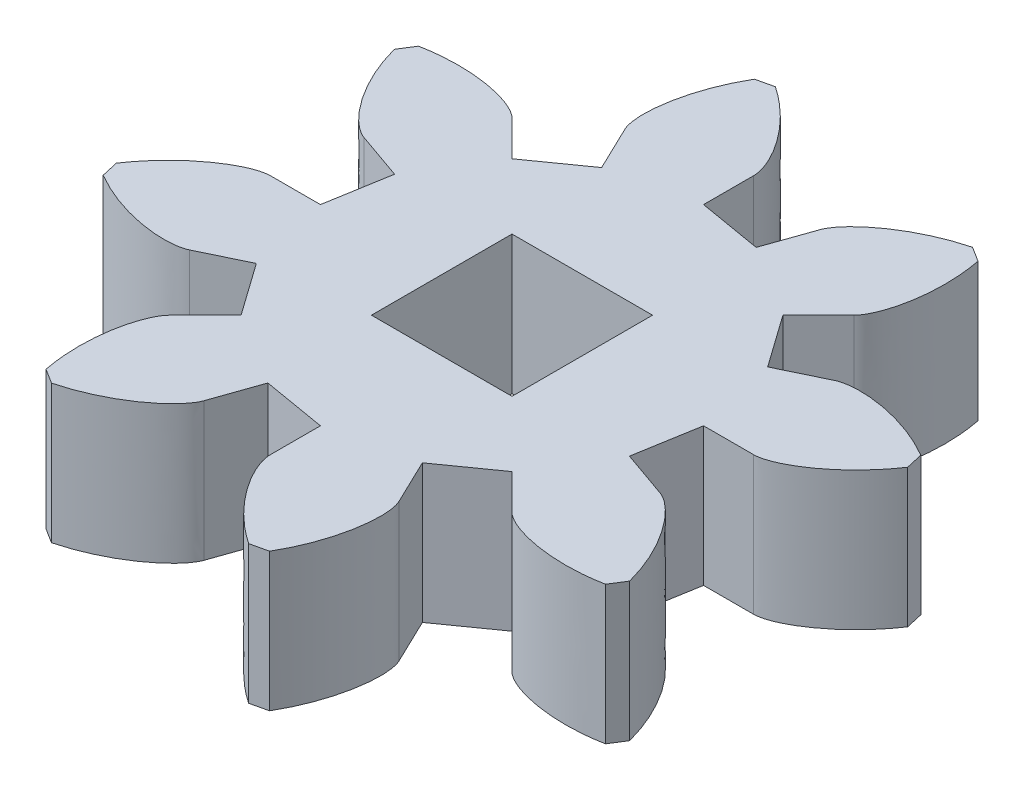
from build123d import *

# Parameters (mm, degrees)
BOSS_EXTRUDE1_DEPTH = 1.5
CIRPATTERN1_COUNT   = 8
SKETCH4_W           = 3.05
SKETCH4_H           = 3.05
CUT_EXTRUDE1_DEPTH  = 11.547606867


with BuildPart() as part:
    # Sketch5 → Boss-Extrude1 (new, symmetric)
    with BuildSketch(Plane(origin=(0, 0, 0), x_dir=(1, 0, 0), z_dir=(0, 1, 0))):
        with BuildLine():
            Line((0, 0), (3.342855658, 2.370565581))
            Line((3.342855658, 2.370565581), (3.746267067, 1.80169155))
            Line((3.746267067, 1.80169155), (4.726512919, 2.273109454))
            add(Edge.make_bspline(
                [(4.726512919, 2.273109454), (5.083840243, 2.444954607), (6.11501814, 2.361263688), (7.066052624, 1.805087159)],
                knots=[0, 0, 0, 0, 1, 1, 1, 1], degree=3))
            Line((7.066052624, 1.805087159), (7.108150593, 1.620429032))
            Line((7.108150593, 1.620429032), (7.150245001, 1.435770094))
            add(Edge.make_bspline(
                [(5.244706948, 7.012e-06), (5.641208616, 1.0552e-05), (6.534229602, 0.522356744), (7.150245001, 1.435770094)],
                knots=[0, 0, 0, 0, 1, 1, 1, 1], degree=3))
            Line((5.244706948, 7.012e-06), (4.156995234, -2.698e-06))
            Line((4.156995234, -2.698e-06), (4.039998902, -0.687512906))
            Line((4.039998902, -0.687512906), (0, 0))
        make_face()
    boss_extrude1 = extrude(amount=BOSS_EXTRUDE1_DEPTH, both=True)

    # CirPattern1: Boss-Extrude1 ×8 about axis
    cirpattern1_axis = Axis((0, -1.5, 0), (0, 1, 0))
    for i in range(1, CIRPATTERN1_COUNT):
        add(boss_extrude1.rotate(cirpattern1_axis, i * 360 / CIRPATTERN1_COUNT))

    # Sketch4 → Cut-Extrude1 (cut, through all)
    with BuildSketch(Plane(origin=(0, 1.5, 0), x_dir=(1, 0, 0), z_dir=(0, 1, 0))):
        Rectangle(SKETCH4_W, SKETCH4_H)
    extrude(amount=-CUT_EXTRUDE1_DEPTH, mode=Mode.SUBTRACT)


solid = part.part
